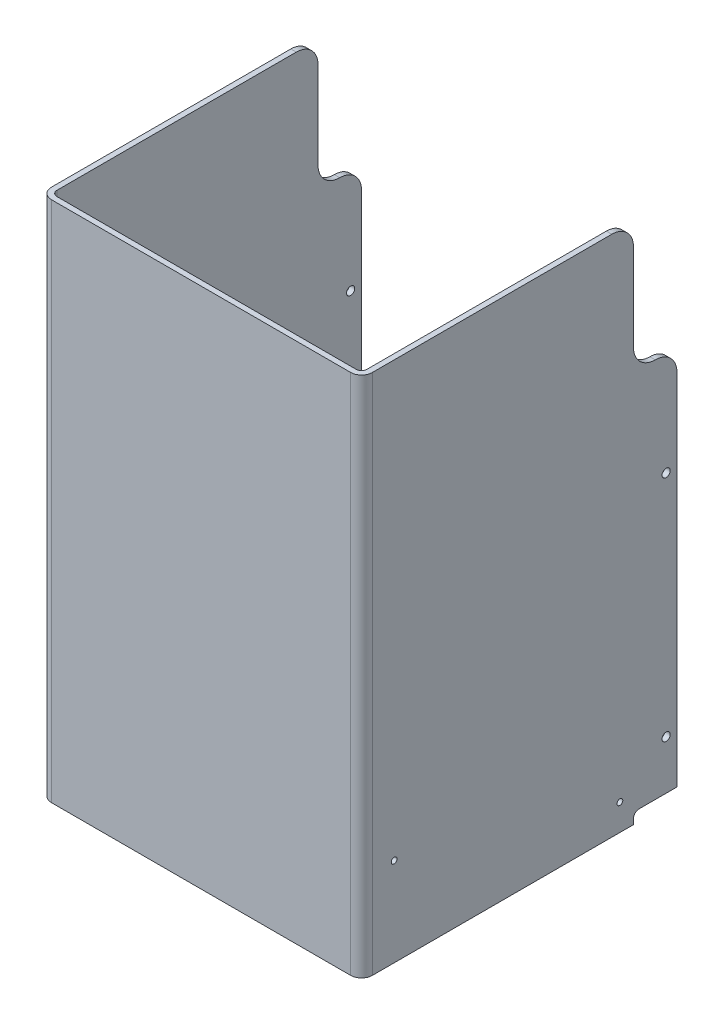
from build123d import *

# Parameters (mm, degrees)
BOSS_EXTRUDE1_DEPTH = 609.6
FILLET1_R           = 6.35
FILLET2_R           = 12.7
SKETCH2_W           = 50.8
SKETCH2_H           = 12.7
CUT_EXTRUDE1_DEPTH  = 805.748204409
SKETCH4_W           = 50.8
SKETCH4_H           = 152.4
CUT_EXTRUDE2_DEPTH  = 805.748204409
SKETCH5_R           = 3.3782
CUT_EXTRUDE3_DEPTH  = 805.748204409
SKETCH6_R           = 4.7625
CUT_EXTRUDE4_DEPTH  = 805.748204409
FILLET3_R           = 25.4
FILLET4_R           = 6.35


with BuildPart() as part:
    # Sketch1 → Boss-Extrude1 (new body)
    with BuildSketch(Plane(origin=(0, 0, 0), x_dir=(1, 0, 0), z_dir=(0, 1, 0))):
        Polygon((0, 0), (0, -368.3), (374.65, -368.3), (374.65, 0), (368.3, 0), (368.3, -361.95), (6.35, -361.95), (6.35, 0), align=None)
    extrude(amount=BOSS_EXTRUDE1_DEPTH)

    # Fillet1
    fillet1_edges = [part.edges().sort_by_distance(p)[0] for p in [
        (6.35, 304.8, 361.95),
        (368.3, 304.8, 361.95),
    ]]
    fillet(fillet1_edges, radius=FILLET1_R)

    # Fillet2
    fillet2_edges = [part.edges().sort_by_distance(p)[0] for p in [
        (374.65, 304.8, 368.3),
        (0, 304.8, 368.3),
    ]]
    fillet(fillet2_edges, radius=FILLET2_R)

    # Sketch2 → Cut-Extrude1 (cut, through all)
    with BuildSketch(Plane(origin=(374.65, 0, 0), x_dir=(0, 0, -1), z_dir=(1, 0, 0))):
        with Locations((-25.4, 6.35)):
            Rectangle(SKETCH2_W, SKETCH2_H)
    extrude(amount=-CUT_EXTRUDE1_DEPTH, mode=Mode.SUBTRACT)

    # Sketch4 → Cut-Extrude2 (cut, through all)
    with BuildSketch(Plane(origin=(374.65, 0, 0), x_dir=(0, 0, -1), z_dir=(1, 0, 0))):
        with Locations((-25.4, 533.4)):
            Rectangle(SKETCH4_W, SKETCH4_H)
    extrude(amount=-CUT_EXTRUDE2_DEPTH, mode=Mode.SUBTRACT)

    # Sketch5 → Cut-Extrude3 (cut, through all)
    with BuildSketch(Plane(origin=(374.65, 0, 0), x_dir=(0, 0, -1), z_dir=(1, 0, 0))):
        with Locations((-330.2, 103.432077108)):
            Circle(SKETCH5_R)
        with Locations((-66.675, 30.736970621)):
            Circle(SKETCH5_R)
    extrude(amount=-CUT_EXTRUDE3_DEPTH, mode=Mode.SUBTRACT)

    # Sketch6 → Cut-Extrude4 (cut, through all)
    with BuildSketch(Plane(origin=(374.65, 0, 0), x_dir=(0, 0, -1), z_dir=(1, 0, 0))):
        with Locations((-12.7, 69.85)):
            Circle(SKETCH6_R)
        with Locations((-12.7, 336.55)):
            Circle(SKETCH6_R)
    extrude(amount=-CUT_EXTRUDE4_DEPTH, mode=Mode.SUBTRACT)

    # Fillet3
    fillet3_edges = [part.edges().sort_by_distance(p)[0] for p in [
        (3.175, 457.2, 0),
        (371.475, 457.2, 0),
        (371.475, 457.2, 50.8),
        (3.175, 457.2, 50.8),
        (3.175, 609.6, 50.8),
        (371.475, 609.6, 50.8),
    ]]
    fillet(fillet3_edges, radius=FILLET3_R - 0.0001)  # a hair under: the kernel refuses the full size

    # Fillet4
    fillet4_edges = [part.edges().sort_by_distance(p)[0] for p in [
        (371.475, 12.7, 50.8),
        (3.175, 12.7, 50.8),
    ]]
    fillet(fillet4_edges, radius=FILLET4_R)


solid = part.part
